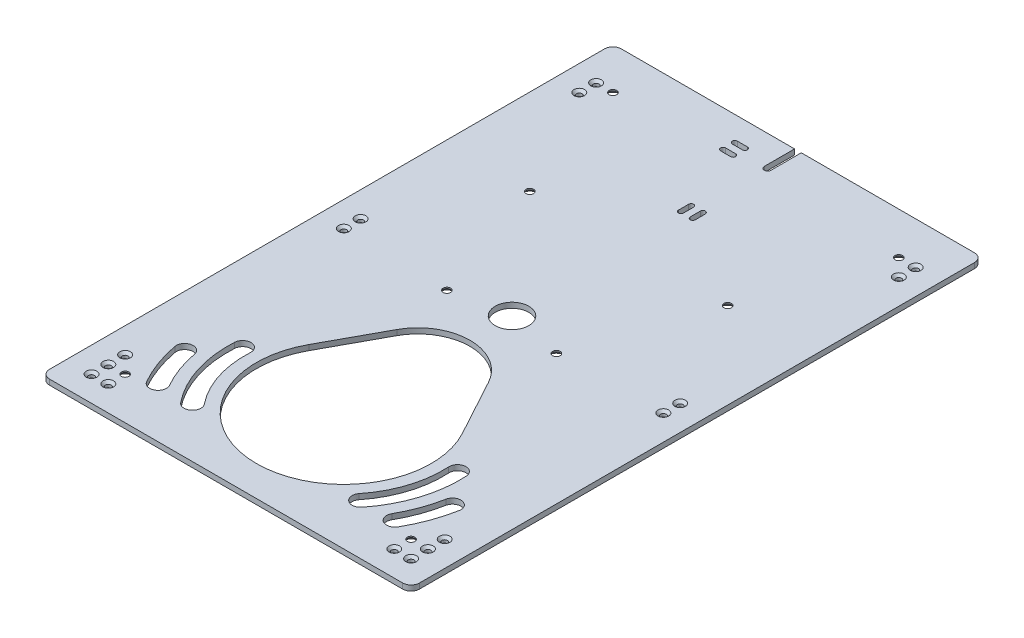
from build123d import *

# Parameters (mm, degrees)
SKETCH1_W                                       = 220
SKETCH1_H                                       = 340
BOSS_EXTRUDE1_DEPTH                             = 3.175
FILLET1_R                                       = 5
SKETCH2_R                                       = 10
CUT_EXTRUDE1_DEPTH                              = 203.509458112
CSK_FOR_M3_FLAT_HEAD_MACHINE_SCREW1_D           = 3.4
CSK_FOR_M3_FLAT_HEAD_MACHINE_SCREW1_CSINK_D     = 6.3
CSK_FOR_M3_FLAT_HEAD_MACHINE_SCREW1_CSINK_ANGLE = 90
CSK_FOR_M4_FLAT_HEAD_MACHINE_SCREW1_AT_2_COUNT  = 2
CSK_FOR_M4_FLAT_HEAD_MACHINE_SCREW1_AT_2_PITCH  = 290
CSK_FOR_M4_FLAT_HEAD_MACHINE_SCREW1_AT_3_COUNT  = 2
CSK_FOR_M4_FLAT_HEAD_MACHINE_SCREW1_AT_3_PITCH  = 148.413565465
CSK_FOR_M4_FLAT_HEAD_MACHINE_SCREW1_AT_4_COUNT  = 2
CSK_FOR_M4_FLAT_HEAD_MACHINE_SCREW1_AT_4_PITCH  = 216.016881764
CUT_EXTRUDE2_DEPTH                              = 203.509458112


with BuildPart() as part:
    # Sketch1 → Boss-Extrude1 (new body)
    with BuildSketch(Plane(origin=(0, 0, 0), x_dir=(1, 0, 0), z_dir=(0, 1, 0))):
        Rectangle(SKETCH1_W, SKETCH1_H)
    extrude(amount=BOSS_EXTRUDE1_DEPTH)

    # Fillet1
    fillet1_edges = [part.edges().sort_by_distance(p)[0] for p in [
        (110, 1.5875, -170),
        (-110, 1.5875, -170),
        (-110, 1.5875, 170),
        (110, 1.5875, 170),
    ]]
    fillet(fillet1_edges, radius=FILLET1_R)

    # Sketch2 → Cut-Extrude1 (cut, through all)
    with BuildSketch(Plane(origin=(0, 3.175, 0), x_dir=(1, 0, 0), z_dir=(0, 1, 0))):
        Circle(SKETCH2_R)
        with BuildLine():
            Line((-27.196280021, -41.167293162), (-45.681234259, -75.155989926))
            ThreePointArc((-45.681234259, -75.155989926), (0, -152), (45.681234259, -75.155989926))
            Line((45.681234259, -75.155989926), (27.196280021, -41.167293162))
            ThreePointArc((27.196280021, -41.167293162), (0, -25), (-27.196280021, -41.167293162))
        make_face()
        with BuildLine():
            Line((2, 170), (2, 152))
            ThreePointArc((2, 152), (0, 150), (-2, 152))
            Line((-2, 152), (-2, 170))
            ThreePointArc((-2, 170), (0, 172), (2, 170))
        make_face()
        with BuildLine():
            Line((-2, 110), (-2, 104))
            ThreePointArc((-2, 104), (-3.5, 102.5), (-5, 104))
            Line((-5, 104), (-5, 110))
            ThreePointArc((-5, 110), (-3.5, 111.5), (-2, 110))
        make_face()
        with BuildLine():
            Line((2, 110), (2, 104))
            ThreePointArc((2, 104), (3.5, 102.5), (5, 104))
            Line((5, 104), (5, 110))
            ThreePointArc((5, 110), (3.5, 111.5), (2, 110))
        make_face()
        with BuildLine():
            Line((-23, 157), (-17, 157))
            ThreePointArc((-17, 157), (-15.5, 155.5), (-17, 154))
            Line((-17, 154), (-23, 154))
            ThreePointArc((-23, 154), (-24.5, 155.5), (-23, 157))
        make_face()
        with BuildLine():
            Line((-23, 147), (-17, 147))
            ThreePointArc((-17, 147), (-15.5, 148.5), (-17, 150))
            Line((-17, 150), (-23, 150))
            ThreePointArc((-23, 150), (-24.5, 148.5), (-23, 147))
        make_face()
    extrude(amount=-CUT_EXTRUDE1_DEPTH, mode=Mode.SUBTRACT)

    # CSK for M3 Flat Head Machine Screw1 (through all)
    with Locations(Plane(origin=(0, 3.175, 0), x_dir=(-1, 0, 0), z_dir=(0, 1, 0))):
        with Locations((85, 155), (95, 155), (95, 145), (95, 135), (95, 5), (95, -5), (95, -135), (95, -145)):
            csk_for_m3_flat_head_machine_screw1 = CounterSinkHole(CSK_FOR_M3_FLAT_HEAD_MACHINE_SCREW1_D / 2, CSK_FOR_M3_FLAT_HEAD_MACHINE_SCREW1_CSINK_D / 2, counter_sink_angle=CSK_FOR_M3_FLAT_HEAD_MACHINE_SCREW1_CSINK_ANGLE)

    # Mirror3: CSK for M3 Flat Head Machine Screw1 across plane
    add(csk_for_m3_flat_head_machine_screw1.mirror(Plane(origin=(0, 0, 0), x_dir=(0, 0, 1), z_dir=(1, 0, 0))), mode=Mode.SUBTRACT)

    # Sketch5 → CSK for M4 Flat Head Machine Screw1 (revolve, cut)
    with BuildSketch(Plane(origin=(85, 0, 145), x_dir=(0, 0, -1), z_dir=(1, 0, 0))):
        Polygon((0, 0), (0, 3.175), (2.25, 3.175), (2.25, 2.45), (4.7, 0), align=None)
    csk_for_m4_flat_head_machine_screw1 = revolve(axis=Axis((85, -6.35, 145), (0, 1, 0)), mode=Mode.SUBTRACT)

    # CSK for M4 Flat Head Machine Screw1 at 2: CSK for M4 Flat Head Machine Screw1 ×2
    with Locations(*[(0, 0, -i * CSK_FOR_M4_FLAT_HEAD_MACHINE_SCREW1_AT_2_PITCH) for i in range(1, CSK_FOR_M4_FLAT_HEAD_MACHINE_SCREW1_AT_2_COUNT)]):
        add(csk_for_m4_flat_head_machine_screw1, mode=Mode.SUBTRACT)

    # CSK for M4 Flat Head Machine Screw1 at 3: CSK for M4 Flat Head Machine Screw1 ×2
    with Locations(*[Vector(-0.35336144759203497, 0, -0.9354868718243252) * (i * CSK_FOR_M4_FLAT_HEAD_MACHINE_SCREW1_AT_3_PITCH) for i in range(1, CSK_FOR_M4_FLAT_HEAD_MACHINE_SCREW1_AT_3_COUNT)]):
        add(csk_for_m4_flat_head_machine_screw1, mode=Mode.SUBTRACT)

    # CSK for M4 Flat Head Machine Screw1 at 4: CSK for M4 Flat Head Machine Screw1 ×2
    with Locations(*[Vector(-0.12138780984794953, 0, -0.9926051579658037) * (i * CSK_FOR_M4_FLAT_HEAD_MACHINE_SCREW1_AT_4_PITCH) for i in range(1, CSK_FOR_M4_FLAT_HEAD_MACHINE_SCREW1_AT_4_COUNT)]):
        add(csk_for_m4_flat_head_machine_screw1, mode=Mode.SUBTRACT)

    # Mirror4: CSK for M4 Flat Head Machine Screw1 across plane
    add(csk_for_m4_flat_head_machine_screw1.mirror(Plane(origin=(0, 0, 0), x_dir=(0, 0, 1), z_dir=(1, 0, 0))), mode=Mode.SUBTRACT)

    # Mirror4 copy 1 sketch → Mirror4 copy 1 (revolve, cut)
    with BuildSketch(Plane(origin=(-85, 0, -145), x_dir=(0, 0, -1), z_dir=(-1, 0, 0))):
        Polygon((0, 0), (0, -3.175), (2.25, -3.175), (2.25, -2.45), (4.7, 0), align=None)
    revolve(axis=Axis((-85, -6.35, -145), (0, -1, 0)), mode=Mode.SUBTRACT)

    # Mirror4 copy 2 sketch → Mirror4 copy 2 (revolve, cut)
    with BuildSketch(Plane(origin=(-32.556367665, 0, 6.161057907), x_dir=(0, 0, -1), z_dir=(-1, 0, 0))):
        Polygon((0, 0), (0, -3.175), (2.25, -3.175), (2.25, -2.45), (4.7, 0), align=None)
    revolve(axis=Axis((-32.556367665, -6.35, 6.161057907), (0, -1, 0)), mode=Mode.SUBTRACT)

    # Mirror4 copy 3 sketch → Mirror4 copy 3 (revolve, cut)
    with BuildSketch(Plane(origin=(-58.778183832, 0, -69.419471047), x_dir=(0, 0, -1), z_dir=(-1, 0, 0))):
        Polygon((0, 0), (0, -3.175), (2.25, -3.175), (2.25, -2.45), (4.7, 0), align=None)
    revolve(axis=Axis((-58.778183832, -6.35, -69.419471047), (0, -1, 0)), mode=Mode.SUBTRACT)

    # Sketch7 → Cut-Extrude2 (cut, through all)
    with BuildSketch(Plane(origin=(0, 3.175, 0), x_dir=(1, 0, 0), z_dir=(0, 1, 0))):
        with BuildLine():
            ThreePointArc((53.863107736, -143.125), (65.742634228, -120.950084602), (68.883402568, -95.99040518))
            ThreePointArc((68.883402568, -95.99040518), (63.601301308, -91.289404619), (58.900300747, -96.571505879))
            ThreePointArc((58.900300747, -96.571505879), (56.214716224, -117.913840457), (46.056860238, -136.875))
            ThreePointArc((46.056860238, -136.875), (46.834983987, -143.903123749), (53.863107736, -143.125))
        make_face()
        with BuildLine():
            ThreePointArc((74.685476761, -114.074074074), (71.35648023, -126.158224886), (66.086566204, -137.530864198))
            ThreePointArc((66.086566204, -137.530864198), (67.965230809, -144.347800408), (74.78216702, -142.469135802))
            ThreePointArc((74.78216702, -142.469135802), (80.745490786, -129.600096582), (84.512513176, -115.925925926))
            ThreePointArc((84.512513176, -115.925925926), (80.524920894, -110.086481792), (74.685476761, -114.074074074))
        make_face()
    cut_extrude2 = extrude(amount=-CUT_EXTRUDE2_DEPTH, mode=Mode.SUBTRACT)

    # Mirror5: Cut-Extrude2 across plane
    add(cut_extrude2.mirror(Plane(origin=(0, 0, 0), x_dir=(0, 0, 1), z_dir=(1, 0, 0))), mode=Mode.SUBTRACT)


solid = part.part
